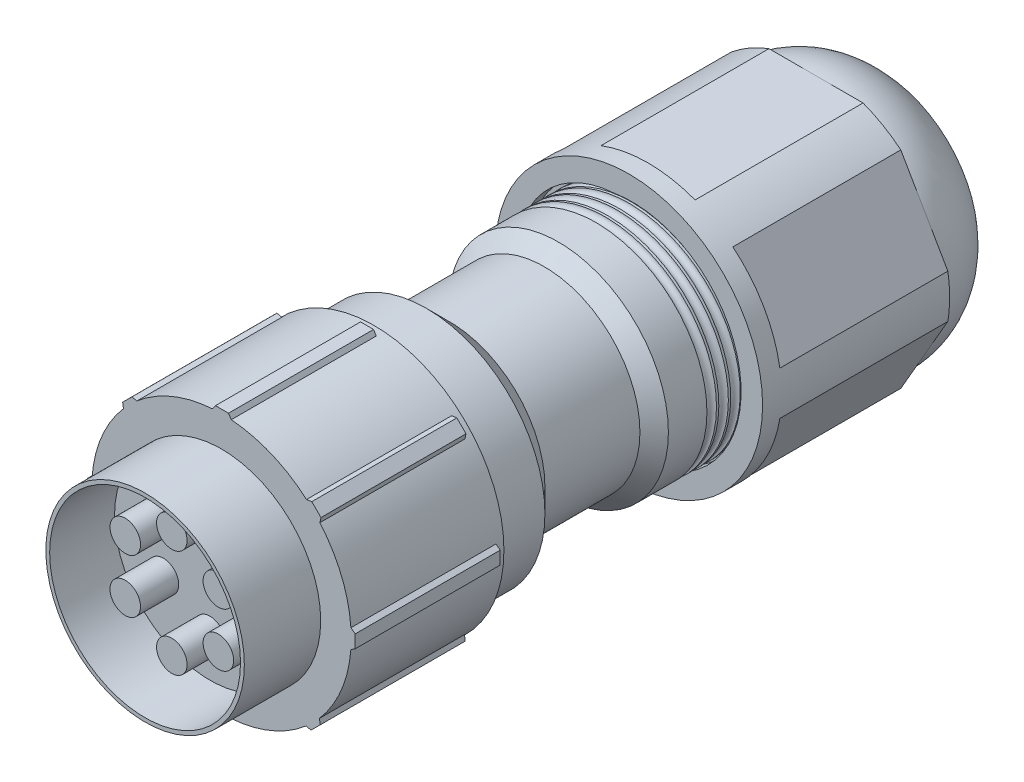
from build123d import *

# Parameters (mm, degrees)
SKETCH1_R           = 8.5
BOSS_EXTRUDE1_DEPTH = 10
SKETCH2_R           = 6.5
BOSS_EXTRUDE2_DEPTH = 5
BOSS_EXTRUDE3_START = 3.5
SKETCH4_R           = 7.195040541
BOSS_EXTRUDE3_DEPTH = 3.5
CUT_SWEEP2_PITCH    = 0.777777778
SKETCH7_R           = 8.75
BOSS_EXTRUDE5_DEPTH = 11.5
SKETCH10_R          = 3
CUT_EXTRUDE1_DEPTH  = 3
SKETCH11_R          = 6.25
CUT_EXTRUDE2_DEPTH  = 4.25
SKETCH12_R          = 1
BOSS_EXTRUDE6_DEPTH = 2.5
CIRPATTERN4_COUNT   = 6
BOSS_EXTRUDE7_DEPTH = 9.5
CIRPATTERN2_COUNT   = 8
BOSS_EXTRUDE8_START = 0.75
BOSS_EXTRUDE8_DEPTH = 0.75
CUT_EXTRUDE3_DEPTH  = 11
CIRPATTERN3_COUNT   = 6


with BuildPart() as part:
    # Sketch1 → Boss-Extrude1 (new body)
    with BuildSketch(Plane.XY):
        Circle(SKETCH1_R)
    extrude(amount=-BOSS_EXTRUDE1_DEPTH)

    # Sketch2 → Boss-Extrude2 (add)
    with BuildSketch(Plane.XY):
        Circle(SKETCH2_R)
    extrude(amount=BOSS_EXTRUDE2_DEPTH)

    # Sketch3 → Revolve1 (revolve)
    with BuildSketch(Plane(origin=(0, 0, 0), x_dir=(0, 0, -1), z_dir=(1, 0, 0)), mode=Mode.PRIVATE) as revolve1_sk:
        Polygon((10, 7.766162729), (13.419300919, 7.766162729), (14.922254046, 6.263209602), (21.14447999, 6.263209602), (22.076310929, 7.195040541), (23.939972806, 7.195040541), (23.939972806, 0), (10, 0), align=None)
    revolve(revolve1_sk.sketch.rotate(Axis((0, 0, -23.939972806), (0, 0, 1)), 90), axis=Axis((0, 0, -23.939972806), (0, 0, 1)))

    # Sketch4 → Boss-Extrude3 (add)
    with BuildSketch(Plane(origin=(0, 0, -23.939972806), x_dir=(-1, 0, 0), z_dir=(0, 0, -1)).offset(BOSS_EXTRUDE3_START)):
        Circle(SKETCH4_R)
    extrude(amount=-BOSS_EXTRUDE3_DEPTH)

    # Cut-Sweep2: arcs per turn and ends read off the stored shape
    # Cut-Sweep2: the profile of Sketch6 screwed along a right-hand helix through 4 turns, 8 arcs to a turn; built about Z, then put on its axis
    cut_sweep2_z = Axis((0, 0, 0), (0, 0, 1))
    cut_sweep2_corners = [(-7.195040541, 0, -0.312225385), (-6.882815156, 0, 0), (-7.195040541, 0, 0.312225385), (-7.507265926, 0, 0)]
    with BuildLine(mode=Mode.PRIVATE) as cut_sweep2_profile:
        ThreePointArc((-7.195040541, 0, -0.312225385), (-6.974263854, 0, -0.220776687), (-6.882815156, 0, 0))
        ThreePointArc((-6.882815156, 0, 0), (-6.974263854, 0, 0.220776687), (-7.195040541, 0, 0.312225385))
        ThreePointArc((-7.195040541, 0, 0.312225385), (-7.415817228, 0, 0.220776687), (-7.507265926, 0, 0))
        ThreePointArc((-7.507265926, 0, 0), (-7.415817228, 0, -0.220776687), (-7.195040541, 0, -0.312225385))
    cut_sweep2_cap = Face(cut_sweep2_profile.wire())
    cut_sweep2_arcs = [((-7.195040541, 0, -0.312225385), (-6.882815156, 0, -0.312225385), (-6.882815156, 0, 0), (1, 0.7071067811865476, 1)), ((-6.882815156, 0, 0), (-6.882815156, 0, 0.312225385), (-7.195040541, 0, 0.312225385), (1, 0.7071067811865476, 1)), ((-7.195040541, 0, 0.312225385), (-7.507265926, 0, 0.312225385), (-7.507265926, 0, 0), (1, 0.7071067811865476, 1)), ((-7.507265926, 0, 0), (-7.507265926, 0, -0.312225385), (-7.195040541, 0, -0.312225385), (1, 0.7071067811865476, 1))]  # start, shoulder, end, weights
    cut_sweep2_turn_angles = [0, 22.5, 45, 67.5, 90, 112.5, 135, 157.5, 180, 202.5, 225, 247.5, 270, 292.5, 315, 337.5, 360]
    cut_sweep2_turn_weights = [1, 0.9238795325112867, 1, 0.9238795325112867, 1, 0.9238795325112867, 1, 0.9238795325112867, 1, 0.9238795325112867, 1, 0.9238795325112867, 1, 0.9238795325112867, 1, 0.9238795325112867, 1]
    cut_sweep2_turn_sides = [Face.make_bezier_surface([[Vector(p[j][0], p[j][1], 0).rotate(cut_sweep2_z, cut_sweep2_turn_angles[2 * i + k]) / cut_sweep2_turn_weights[2 * i + k] + Vector(0, 0, p[j][2] + CUT_SWEEP2_PITCH * cut_sweep2_turn_angles[2 * i + k] / 360) for k in range(3)] for j in range(3)], [[p[3][j] * cut_sweep2_turn_weights[2 * i + k] for k in range(3)] for j in range(3)]) for p in cut_sweep2_arcs for i in range(8)]
    cut_sweep2 = Plane(origin=(0, 0, -27.439972806), x_dir=(0, 1, 0), z_dir=(0, 0, 1)) * Solid(Shell([*[p.moved(Location((0, 0, CUT_SWEEP2_PITCH * i))) for i in range(4) for p in cut_sweep2_turn_sides], cut_sweep2_cap, cut_sweep2_cap.rotate(cut_sweep2_z, 1440).moved(Location((0, 0, CUT_SWEEP2_PITCH * 1440 / 360)))]))
    add(cut_sweep2, mode=Mode.SUBTRACT)

    # Sketch7 → Boss-Extrude5 (add)
    with BuildSketch(Plane(origin=(0, 0, -27.439972806), x_dir=(-1, 0, 0), z_dir=(0, 0, -1))):
        Circle(SKETCH7_R)
    extrude(amount=BOSS_EXTRUDE5_DEPTH)

    # Sketch8 → Revolve3 (revolve)
    with BuildSketch(Plane(origin=(0, 0, 0), x_dir=(0, 0, -1), z_dir=(1, 0, 0)), mode=Mode.PRIVATE) as revolve3_sk:
        with BuildLine():
            Line((38.939972806, 0), (38.939972806, 8.190865712))
            ThreePointArc((38.939972806, 8.190865712), (41.2665522, 7.781579121), (43.155119701, 6.362494914))
            Line((43.155119701, 6.362494914), (43.155119701, 0))
            Line((43.155119701, 0), (41.997846182, 0))
            Line((41.997846182, 0), (38.939972806, 0))
        make_face()
    revolve(revolve3_sk.sketch.rotate(Axis((0, 0, -41.997846182), (0, 0, 1)), 90), axis=Axis((0, 0, -41.997846182), (0, 0, 1)))

    # Sketch10 → Cut-Extrude1 (cut)
    with BuildSketch(Plane(origin=(0, 0, -43.155119701), x_dir=(-1, 0, 0), z_dir=(0, 0, -1))):
        Circle(SKETCH10_R)
    extrude(amount=-CUT_EXTRUDE1_DEPTH, mode=Mode.SUBTRACT)

    # Sketch11 → Cut-Extrude2 (cut)
    with BuildSketch(Plane.XY.offset(5)):
        Circle(SKETCH11_R)
    extrude(amount=-CUT_EXTRUDE2_DEPTH, mode=Mode.SUBTRACT)

    # Sketch12 → Boss-Extrude6 (add)
    with BuildSketch(Plane.XY.offset(0.75)):
        with Locations((0, 3.43)):
            Circle(SKETCH12_R)
    boss_extrude6 = extrude(amount=BOSS_EXTRUDE6_DEPTH)

    # CirPattern4: Boss-Extrude6 ×6 about axis
    cirpattern4_axis = Axis((0, -0.090114943, 0), (0, 0, 1))
    for i in range(1, CIRPATTERN4_COUNT):
        add(boss_extrude6.rotate(cirpattern4_axis, i * 360 / CIRPATTERN4_COUNT))

    # Sketch14 → Boss-Extrude7 (add)
    with BuildSketch(Plane.XY):
        Polygon((-0.597109583, 8.479001129), (0.022890417, 8.471229408), (0.642890417, 8.47565289), (0.46177716, 8.75565289), (-0.388250759, 8.759001129), align=None)
    boss_extrude7 = extrude(amount=-BOSS_EXTRUDE7_DEPTH)

    # CirPattern2: Boss-Extrude7 ×8 about axis
    cirpattern2_axis = Axis((0, 0, 0), (0, 0, 1))
    for i in range(1, CIRPATTERN2_COUNT):
        add(boss_extrude7.rotate(cirpattern2_axis, i * 360 / CIRPATTERN2_COUNT))

    # Sketch15 → Boss-Extrude8 (add)
    with BuildSketch(Plane.XY.offset(-27.439972806).offset(BOSS_EXTRUDE8_START)):
        with BuildLine():
            ThreePointArc((-0.988548069, 8.693979107), (-6.527338493, 5.827207925), (-8.75, 0))
            ThreePointArc((-8.75, 0), (-6.29519092, -6.077258533), (-0.308155135, -8.744572054))
            ThreePointArc((-0.308155135, -8.744572054), (6.077258533, -6.29519092), (8.75, 0))
            ThreePointArc((8.75, 0), (5.827207925, 6.527338493), (-0.988548069, 8.693979107))
        make_face()
        with BuildLine():
            ThreePointArc((-0.988548069, 7.17422776), (-5.618268786, 4.889355548), (-7.276327064, 0))
            ThreePointArc((-7.276327064, 0), (-5.927223364, -4.357933307), (-2.21659335, -7.011777387))
            ThreePointArc((-2.21659335, -7.011777387), (5.102583825, -5.238548112), (7.08034461, 2.028030096))
            ThreePointArc((7.08034461, 2.028030096), (4.036675809, 6.154601637), (-0.988548069, 7.17422776))
        make_face(mode=Mode.SUBTRACT)
    extrude(amount=-BOSS_EXTRUDE8_DEPTH)

    # Sketch16 → Cut-Extrude3 (cut)
    with BuildSketch(Plane(origin=(0, 0, -38.939972806), x_dir=(-1, 0, 0), z_dir=(0, 0, -1))):
        Polygon((-0.029619759, 8.851786246), (-3.529619759, 8.851786246), (-3.529619759, 8.189592106), (3.470380241, 8.189592106), (3.470380241, 8.851786246), align=None)
    cut_extrude3 = extrude(amount=-CUT_EXTRUDE3_DEPTH, mode=Mode.SUBTRACT)

    # CirPattern3: Cut-Extrude3 ×6 about axis
    cirpattern3_axis = Axis((0, 0, 0), (0, 0, 1))
    for i in range(1, CIRPATTERN3_COUNT):
        add(cut_extrude3.rotate(cirpattern3_axis, i * 360 / CIRPATTERN3_COUNT), mode=Mode.SUBTRACT)


solid = part.part
